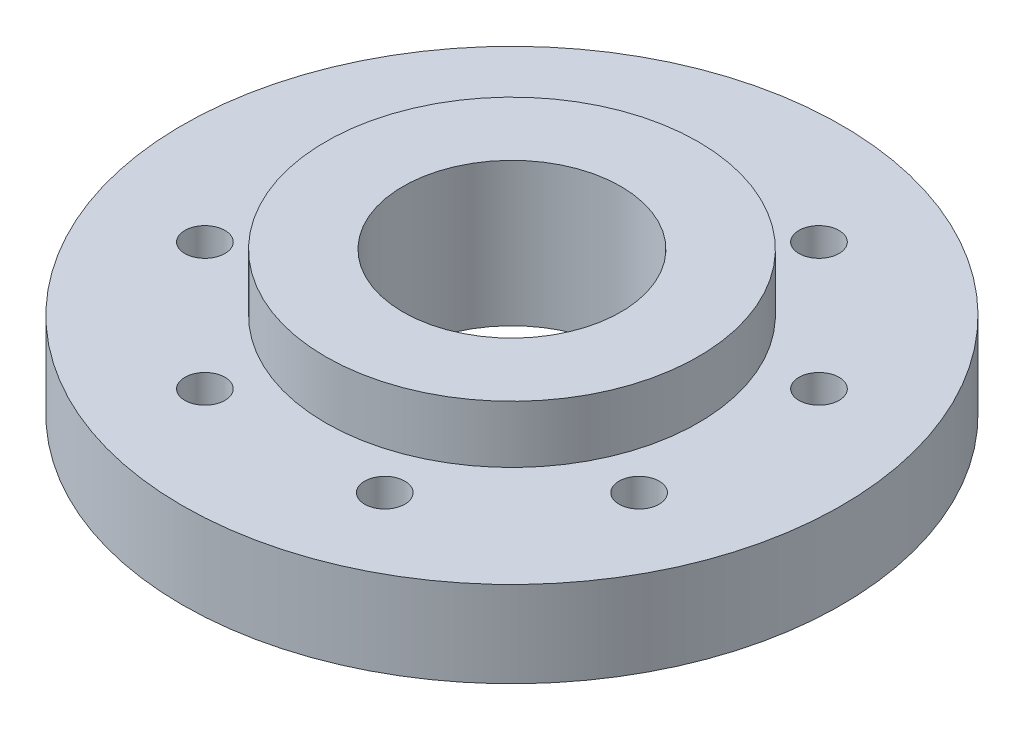
from build123d import *

# Parameters (mm, degrees)
F_01_FLANGE_PROFILE_R     = 115
F_01_FLANGE_PROFILE_R_2   = 38
F_01_FLANGE_PROFILE_R_3   = 7
F_01_FLANGE_EXTRUDE_DEPTH = 30
F_02_HUB_PROFILE_R        = 65
F_02_HUB_PROFILE_R_2      = 38
F_02_LOCATING_HUB_DEPTH   = 50


with BuildPart() as part:
    # 01_Flange_Profile → 01_Flange_Extrude (new body)
    with BuildSketch(Plane(origin=(0, 0, 0), x_dir=(1, 0, 0), z_dir=(0, 1, 0))):
        Circle(F_01_FLANGE_PROFILE_R)
        Circle(F_01_FLANGE_PROFILE_R_2, mode=Mode.SUBTRACT)
        with Locations((75.758121666, 31.380041454)):
            Circle(F_01_FLANGE_PROFILE_R_3, mode=Mode.SUBTRACT)
        with Locations((31.380041454, 75.758121666)):
            Circle(F_01_FLANGE_PROFILE_R_3, mode=Mode.SUBTRACT)
        with Locations((-31.380041454, 75.758121666)):
            Circle(F_01_FLANGE_PROFILE_R_3, mode=Mode.SUBTRACT)
        with Locations((-75.758121666, 31.380041454)):
            Circle(F_01_FLANGE_PROFILE_R_3, mode=Mode.SUBTRACT)
        with Locations((-75.758121666, -31.380041454)):
            Circle(F_01_FLANGE_PROFILE_R_3, mode=Mode.SUBTRACT)
        with Locations((-31.380041454, -75.758121666)):
            Circle(F_01_FLANGE_PROFILE_R_3, mode=Mode.SUBTRACT)
        with Locations((31.380041454, -75.758121666)):
            Circle(F_01_FLANGE_PROFILE_R_3, mode=Mode.SUBTRACT)
        with Locations((75.758121666, -31.380041454)):
            Circle(F_01_FLANGE_PROFILE_R_3, mode=Mode.SUBTRACT)
    extrude(amount=F_01_FLANGE_EXTRUDE_DEPTH)

    # 02_Hub_Profile → 02_Locating_Hub (add)
    with BuildSketch(Plane(origin=(0, 0, 0), x_dir=(1, 0, 0), z_dir=(0, 1, 0))):
        Circle(F_02_HUB_PROFILE_R)
        Circle(F_02_HUB_PROFILE_R_2, mode=Mode.SUBTRACT)
    extrude(amount=F_02_LOCATING_HUB_DEPTH)


solid = part.part
